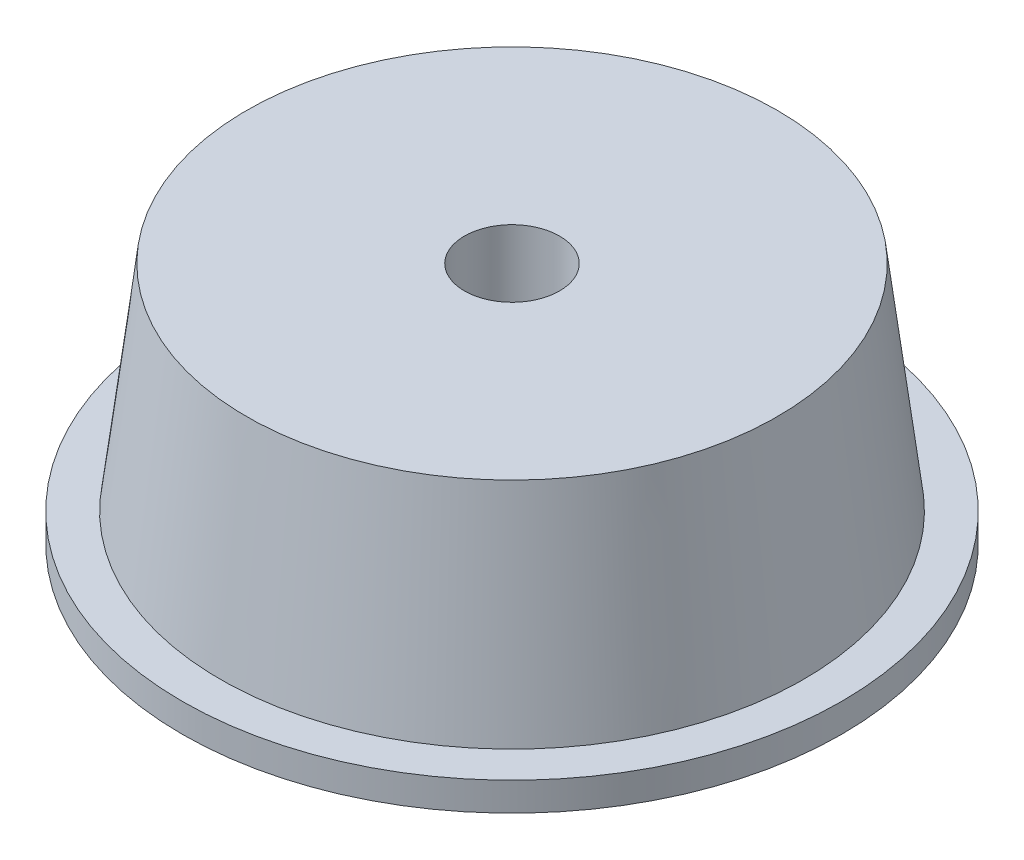
from build123d import *

# Parameters (mm, degrees)
R_VOL_MINCE1_OUTLINE_W = 0.5
R_VOL_MINCE1_OUTLINE_H = 1
CONG_2_R               = 8
CONG_3_R               = 8


# Read off the part's stored shape, not the designer's step: Révol.-Mince1
with BuildPart() as part:
    # Révol.-Mince1 outline → Révol.-Mince1 (revolve)
    with BuildSketch(Plane.XY):
        Polygon((2.5, 5), (2.5, 0), (7, 0), (7, 23.528490035), (26.111064682, 23.528490035), (29, 0), (34.646665968, 0), (34.646665968, 3), (30.646665968, 3), (27.880515211, 25.528490035), (5, 25.528490035), (5, 5), align=None)
        with Locations((4.75, 2.5)):
            Rectangle(R_VOL_MINCE1_OUTLINE_W, R_VOL_MINCE1_OUTLINE_H, mode=Mode.SUBTRACT)
    revolve(axis=Axis((0, 0, 0), (0, 1, 0)))

    # Congé2
    cong_2_edges = [part.edges().sort_by_distance(p)[0] for p in [
        (-26.111064682, 23.528490035, 0),
    ]]
    fillet(cong_2_edges, radius=CONG_2_R)

    # Congé3
    cong_3_edges = [part.edges().sort_by_distance(p)[0] for p in [
        (-7, 23.528490035, 0),
    ]]
    fillet(cong_3_edges, radius=CONG_3_R)


solid = part.part
